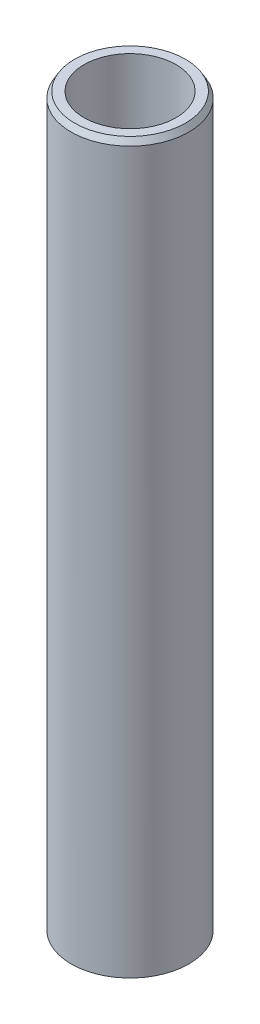
from build123d import *
from OCP.BRepFilletAPI import BRepFilletAPI_MakeChamfer

# Parameters (mm, degrees)
SKETCH1_R           = 40
BOSS_EXTRUDE1_DEPTH = 495.857883521
SKETCH2_R           = 31.265392157
CUT_EXTRUDE1_DEPTH  = 500.074183513
CHAMFER1_SIZE       = 4.083937518
CHAMFER1_SIZE2      = 2.357862425


with BuildPart() as part:
    # Sketch1 → Boss-Extrude1 (new body)
    with BuildSketch(Plane(origin=(0, 0, 0), x_dir=(1, 0, 0), z_dir=(0, 1, 0))):
        Circle(SKETCH1_R)
    extrude(amount=BOSS_EXTRUDE1_DEPTH)

    # Sketch2 → Cut-Extrude1 (cut, through all)
    with BuildSketch(Plane(origin=(0, 0, 0), x_dir=(1, 0, 0), z_dir=(0, 1, 0))):
        Circle(SKETCH2_R)
    extrude(amount=CUT_EXTRUDE1_DEPTH, mode=Mode.SUBTRACT)

    # Chamfer1: one chamfer whose edges measure the first distance from different faces: ONE call of the kernel's chamfer builder (chamfer() names one face for all edges)
    chamfer1_edges_1 = [part.edges().sort_by_distance(p)[0] for p in [
        (-40, 495.857883521, 0),
    ]]
    chamfer1_side_1 = [part.faces().sort_by_distance(p)[0] for p in [
        (-40, 247.92894176, 0),
    ]]
    chamfer1_edges_2 = [part.edges().sort_by_distance(p)[0] for p in [
        (-40, 0, 0),
    ]]
    chamfer1_side_2 = [part.faces().sort_by_distance(p)[0] for p in [
        (-38.86862915, 0, 0),
    ]]
    chamfer1 = BRepFilletAPI_MakeChamfer(part.part.solid().wrapped)
    for e in chamfer1_edges_1:
        chamfer1.Add(CHAMFER1_SIZE, CHAMFER1_SIZE2, e.wrapped, chamfer1_side_1[0].wrapped)  # the first distance lies on this face
    for e in chamfer1_edges_2:
        chamfer1.Add(CHAMFER1_SIZE, CHAMFER1_SIZE2, e.wrapped, chamfer1_side_2[0].wrapped)  # the first distance lies on this face
    add(Compound.cast(chamfer1.Shape()), mode=Mode.REPLACE)


solid = part.part
